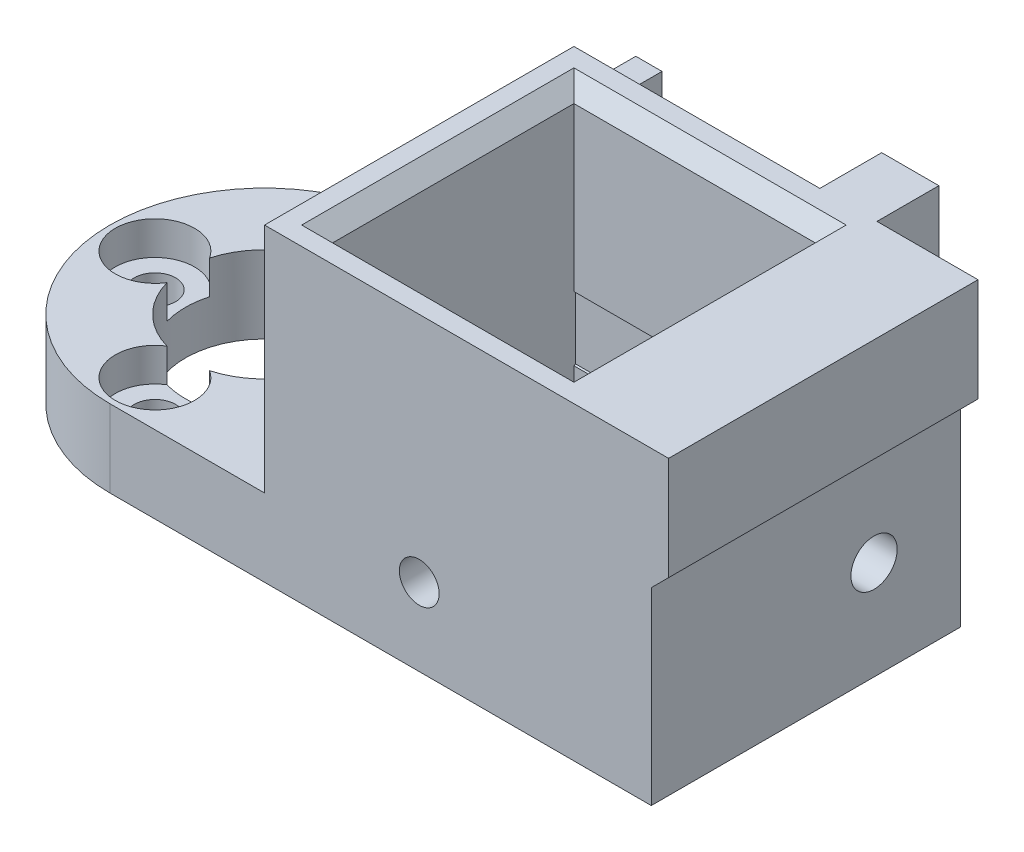
from build123d import *

# Parameters (mm, degrees)
SKETCH1_W                      = 25.4
SKETCH1_H                      = 25.4
SKETCH1_W_2                    = 19.812
SKETCH1_H_2                    = 19.812
BOSS_EXTRUDE1_DEPTH            = 25.4
SKETCH4_W                      = 25.4
SKETCH4_H                      = 25.4
BOSS_EXTRUDE2_DEPTH            = 6.35
F_6_CLEARANCE_HOLE2_D          = 3.7973
F_6_CLEARANCE_HOLE2_DEPTH      = 9.144
CUT_EXTRUDE1_DEPTH             = 5.08
CUT_EXTRUDE1_DIRECTION_2_REACH = 38.297
SKETCH8_W                      = 25.4
SKETCH8_H                      = 9.905999957
BOSS_EXTRUDE4_DEPTH            = 1.4224
SKETCH9_W                      = 25.4
SKETCH9_H                      = 25.4
BOSS_EXTRUDE5_DEPTH            = 6.35
CUT_EXTRUDE2_REACH             = 46.45
SKETCH10_R                     = 6.5
M3_CLEARANCE_HOLE1_D           = 3.4
CIRPATTERN1_COUNT              = 4
FILLET1_R                      = 12.7
SKETCH15_W                     = 19.812
SKETCH15_H                     = 19.812
SKETCH15_W_2                   = 16.002
SKETCH15_H_2                   = 16.002
BOSS_EXTRUDE6_DEPTH            = 2.54
SKETCH17_R                     = 3.25
CUT_EXTRUDE4_DEPTH             = 2.75
CIRPATTERN2_COUNT              = 4
FILLET4_R                      = 1.27
F_4_CLEARANCE_HOLE1_D          = 3.2639
CHAMFER1_SIZE                  = 1.4224
CHAMFER2_SIZE                  = 1.27
SKETCH22_W                     = 10.16
SKETCH22_H                     = 2.54
BOSS_EXTRUDE7_DEPTH            = 5.08
CHAMFER3_SIZE                  = 2.54
BOSS_EXTRUDE8_DEPTH            = 5.08
BOSS_EXTRUDE9_DEPTH            = 2.153
BOSS_EXTRUDE10_DEPTH           = 3.677


with BuildPart() as part:
    # Sketch1 → Boss-Extrude1 (new body)
    with BuildSketch(Plane(origin=(0, 0, 0), x_dir=(1, 0, 0), z_dir=(0, 1, 0))):
        Rectangle(SKETCH1_W, SKETCH1_H)
        Rectangle(SKETCH1_W_2, SKETCH1_H_2, mode=Mode.SUBTRACT)
    extrude(amount=BOSS_EXTRUDE1_DEPTH)

    # Sketch4 → Boss-Extrude2 (add)
    with BuildSketch(Plane(origin=(12.7, 0, 0), x_dir=(0, 0, -1), z_dir=(1, 0, 0))):
        with Locations((0, 12.7)):
            Rectangle(SKETCH4_W, SKETCH4_H)
    extrude(amount=BOSS_EXTRUDE2_DEPTH)

    # #6 Clearance Hole2
    with Locations(Plane(origin=(19.05, 0, 0), x_dir=(0, 0, -1), z_dir=(1, 0, 0))):
        with Locations((5.588, 8.128000043)):
            Hole(F_6_CLEARANCE_HOLE2_D / 2, depth=F_6_CLEARANCE_HOLE2_DEPTH)

    # Sketch7 → Cut-Extrude1 (cut)
    with BuildSketch(Plane.ZY.offset(-9.906)):
        Polygon((-5.588, 13.260643936), (-10.033, 10.69432199), (-10.033, 5.561678096), (-5.588, 2.99535615), (-1.143, 5.561678096), (-1.143, 10.69432199), align=None)
    extrude(amount=-CUT_EXTRUDE1_DEPTH, mode=Mode.SUBTRACT)

    # Cut-Extrude1 direction 2: up to this face of the body (flat: up to its plane)
    cut_extrude1_direction_2_end = Plane(part.part.faces().sort_by_distance((-9.906, 12.7, 0))[0])
    # Sketch7 → Cut-Extrude1 direction 2 (cut, up to the picked face)
    with BuildSketch(Plane.ZY.offset(-9.906), mode=Mode.PRIVATE) as cut_extrude1_direction_2_sk1:
        Polygon((-5.588, 13.260643936), (-10.033, 10.69432199), (-10.033, 5.561678096), (-5.588, 2.99535615), (-1.143, 5.561678096), (-1.143, 10.69432199), align=None)
    cut_extrude1_direction_2_tool1 = split(extrude(cut_extrude1_direction_2_sk1.sketch, amount=CUT_EXTRUDE1_DIRECTION_2_REACH, mode=Mode.PRIVATE), bisect_by=cut_extrude1_direction_2_end, keep=Keep.BOTH, mode=Mode.PRIVATE)
    add(cut_extrude1_direction_2_tool1.solids().sort_by(Axis((9.906, 8.128, -5.588), (-1, 0, 0)))[0], mode=Mode.SUBTRACT)

    # Sketch8 → Boss-Extrude4 (add)
    with BuildSketch(Plane(origin=(19.05, 0, 0), x_dir=(0, 0, -1), z_dir=(1, 0, 0))):
        with Locations((0, 20.447000022)):
            Rectangle(SKETCH8_W, SKETCH8_H)
    extrude(amount=BOSS_EXTRUDE4_DEPTH)

    # Sketch9 → Boss-Extrude5 (add)
    with BuildSketch(Plane.XZ):
        with Locations((-25.4, 0)):
            Rectangle(SKETCH9_W, SKETCH9_H)
    extrude(amount=-BOSS_EXTRUDE5_DEPTH)

    # Sketch10 → Cut-Extrude2 (cut, up to next)
    with BuildSketch(Plane(origin=(0, 6.35, 0), x_dir=(1, 0, 0), z_dir=(0, 1, 0)), mode=Mode.PRIVATE) as cut_extrude2_sk1:
        with Locations(Location((-25.4, 0, 0), (0, 0, 270))):
            Circle(SKETCH10_R)
    cut_extrude2_tool1 = extrude(cut_extrude2_sk1.sketch, amount=-CUT_EXTRUDE2_REACH, mode=Mode.PRIVATE) & part.part
    add(cut_extrude2_tool1.solids().sort_by_distance((-25.4, 6.35, 0))[0], mode=Mode.SUBTRACT)

    # M3 Clearance Hole1 (through all)
    with Locations(Plane(origin=(0, 6.35, 0), x_dir=(1, 0, 0), z_dir=(0, 1, 0))):
        with Locations((-25.4, 9)):
            m3_clearance_hole1 = Hole(M3_CLEARANCE_HOLE1_D / 2)

    # CirPattern1: M3 Clearance Hole1 ×4 about axis
    cirpattern1_axis = Axis((-25.4, 0, 0), (0, 1, 0))
    for i in range(1, CIRPATTERN1_COUNT):
        add(m3_clearance_hole1.rotate(cirpattern1_axis, i * 360 / CIRPATTERN1_COUNT), mode=Mode.SUBTRACT)

    # Fillet1
    fillet1_edges = [part.edges().sort_by_distance(p)[0] for p in [
        (-38.1, 3.175, 12.7),
        (-38.1, 3.175, -12.7),
    ]]
    fillet(fillet1_edges, radius=FILLET1_R - 0.0001)  # a hair under: the kernel refuses the full size

    # Sketch15 → Boss-Extrude6 (add)
    with BuildSketch(Plane.XZ):
        Rectangle(SKETCH15_W, SKETCH15_H)
        Rectangle(SKETCH15_W_2, SKETCH15_H_2, mode=Mode.SUBTRACT)
    extrude(amount=-BOSS_EXTRUDE6_DEPTH)

    # Sketch17 → Cut-Extrude4 (cut)
    with BuildSketch(Plane(origin=(0, 6.35, 0), x_dir=(1, 0, 0), z_dir=(0, 1, 0))):
        with Locations((-25.4, 9)):
            Circle(SKETCH17_R)
    cut_extrude4 = extrude(amount=-CUT_EXTRUDE4_DEPTH, mode=Mode.SUBTRACT)

    # CirPattern2: Cut-Extrude4 ×4 about axis
    cirpattern2_axis = Axis((-25.4, 0, 0), (0, 1, 0))
    for i in range(1, CIRPATTERN2_COUNT):
        add(cut_extrude4.rotate(cirpattern2_axis, i * 360 / CIRPATTERN2_COUNT), mode=Mode.SUBTRACT)

    # Fillet4
    fillet4_edges = [part.edges().sort_by_distance(p)[0] for p in [
        (-8.001, 2.54, 0),
        (0, 2.54, -8.001),
        (8.001, 2.54, 0),
        (0, 2.54, 8.001),
        (-8.001, 0, 0),
        (-8.001, 1.27, 8.001),
        (0, 0, 8.001),
        (8.001, 1.27, 8.001),
        (8.001, 0, 0),
        (8.001, 1.27, -8.001),
        (0, 0, -8.001),
        (-8.001, 1.27, -8.001),
    ]]
    fillet(fillet4_edges, radius=FILLET4_R - 0.0001)  # a hair under: the kernel refuses the full size

    # #4 Clearance Hole1 (through all)
    with Locations(Plane(origin=(0, 0, -12.7), x_dir=(-1, 0, 0), z_dir=(0, 0, -1))):
        with Locations((0, 6.35)):
            Hole(F_4_CLEARANCE_HOLE1_D / 2)

    # Chamfer1
    chamfer1_edges = [part.edges().sort_by_distance(p)[0] for p in [
        (20.4724, 15.494000043, 0),
    ]]
    chamfer(chamfer1_edges, length=CHAMFER1_SIZE - 0.0001)  # a hair under: the kernel refuses the full size

    # Chamfer2
    chamfer2_edges = [part.edges().sort_by_distance(p)[0] for p in [
        (9.906, 25.4, 0),
        (0, 25.4, -9.906),
        (-9.906, 25.4, 0),
        (0, 25.4, 9.906),
    ]]
    chamfer(chamfer2_edges, length=CHAMFER2_SIZE)

    # Sketch22 → Boss-Extrude7 (add)
    with BuildSketch(Plane(origin=(0, 0, -12.7), x_dir=(-1, 0, 0), z_dir=(0, 0, -1))):
        with Locations((2.54, 1.27)):
            Rectangle(SKETCH22_W, SKETCH22_H)
    extrude(amount=BOSS_EXTRUDE7_DEPTH)

    # Chamfer3
    chamfer3_edges = [part.edges().sort_by_distance(p)[0] for p in [
        (-7.62, 1.27, -17.78),
        (2.54, 1.27, -17.78),
    ]]
    chamfer(chamfer3_edges, length=CHAMFER3_SIZE)

    # Sketch23 → Boss-Extrude8 (add)
    with BuildSketch(Plane(origin=(0, 0, -12.7), x_dir=(-1, 0, 0), z_dir=(0, 0, -1))):
        Polygon((12.7, 9.999), (12.7, 22.16), (10.547, 22.16), (10.547, 12.152), (9.023, 12.152), (9.023, 9.999), align=None)
        Polygon((-7.487, 25.4), (-12.18, 25.4), (-12.18, 12.66), (-10.027, 12.66), (-10.027, 23.368), (-7.487, 23.368), align=None)
    extrude(amount=BOSS_EXTRUDE8_DEPTH)

    # Sketch24 → Boss-Extrude9 (add)
    with BuildSketch(Plane(origin=(12.18, 0, 0), x_dir=(0, 0, -1), z_dir=(1, 0, 0))):
        Polygon((17.78, 12.66), (12.7, 12.66), (12.7, 7.58), align=None)
    extrude(amount=-BOSS_EXTRUDE9_DEPTH)

    # Sketch25 → Boss-Extrude10 (add)
    with BuildSketch(Plane.ZY.offset(12.7)):
        Polygon((-17.78, 9.999), (-12.7, 9.999), (-12.7, 4.919), align=None)
    extrude(amount=-BOSS_EXTRUDE10_DEPTH)


solid = part.part
